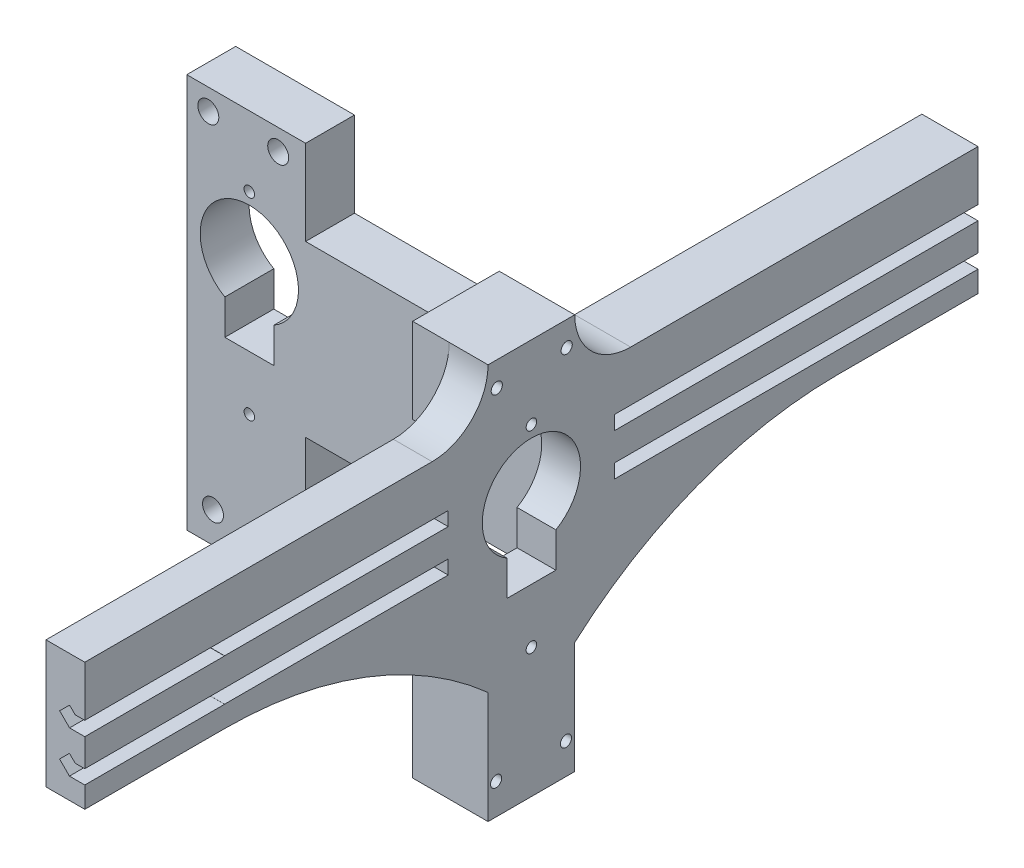
from build123d import *

# Parameters (mm, degrees)
SKETCH1_R                   = 2
BOSS_EXTRUDE3_DEPTH         = 7
SKETCH3_R                   = 1.0000000000000002
SKETCH3_R_2                 = 0.9999999999999998
SKETCH3_R_3                 = 0.9999999999999996
SKETCH3_R_4                 = 0.9999999999999993
CUT_EXTRUDE2_DEPTH          = 26.065122954876703
BOSS_EXTRUDE4_START         = -7
BOSS_EXTRUDE4_DEPTH         = 7
BOSS_EXTRUDE5_START         = -30
BOSS_EXTRUDE5_DEPTH         = 30
FILLET2_R                   = 1.5
CUT_EXTRUDE5_DEPTH          = 42.3486443398461
BOSS_EXTRUDE6_DEPTH         = 10.5
MOVE_START                  = -28.7
MOVE_FACE1_DEPTH            = 5.7
DELETEFACE1_START           = 23.7
DELETEFACE1_OUTLINE_W       = 10.499999999999998
DELETEFACE1_OUTLINE_H       = 35.699999999999996
DELETEFACE1_DEPTH           = 15.7
SKETCH11_OUTSIDE_W          = 51.876
SKETCH11_OUTSIDE_H          = 42.462
CUT_EXTRUDE6_DEPTH          = 46.16926949380306
SERVO_START                 = -12.760864102
SERVO_MICRO_OUTLINE_W       = 22.6
SERVO_MICRO_OUTLINE_H       = 12.399999999999999
SERVO_MICRO_DEPTH           = 22.3
SERVO_START_2               = 9.539135898
SERVO_MICRO_2_DEPTH         = 4.3
SERVO_START_3               = 2.889135898
SERVO_MICRO_3_DEPTH         = 2.4
SERVO_START_4               = 13.839135898
SERVO_MICRO_4_OUTLINE_R     = 2.5
SERVO_MICRO_4_DEPTH         = 3.3
SERVO_START_5               = -25.667487826
SERVO_MICRO_5_OUTLINE_R     = 0.6
SERVO_MICRO_5_DEPTH         = 2.3
SERVO_MICRO_6_OUTLINE_R     = 0.6
SERVO_MICRO_6_DEPTH         = 2.3
SERVO_MICRO_7_OUTLINE_R     = 0.6
SERVO_MICRO_7_DEPTH         = 2.3
BODY_MOVE_COPY1_START       = -28.367487826
BODY_MOVE_COPY1_OUTLINE_W   = 1.4655914419999974
BODY_MOVE_COPY1_OUTLINE_H   = 1.2119180259999993
BODY_MOVE_COPY1_OUTLINE_W_2 = 2.3999999999999995
BODY_MOVE_COPY1_OUTLINE_H_2 = 1.0999999999999943
BODY_MOVE_COPY1_OUTLINE_H_3 = 5.650000000000002
BODY_MOVE_COPY1_DEPTH       = 32.6
BODY_MOVE_COPY1_2_DEPTH     = 23.217487826
BODY_MOVE_COPY1_START_2     = -5.15
BODY_MOVE_COPY1_3_OUTLINE_W = 22.6
BODY_MOVE_COPY1_3_OUTLINE_H = 12.399999999999999
BODY_MOVE_COPY1_3_DEPTH     = 22.3
BODY_MOVE_COPY1_START_3     = 17.15
BODY_MOVE_COPY1_4_DEPTH     = 4.3
BODY_MOVE_COPY1_START_4     = 10.5
BODY_MOVE_COPY1_5_DEPTH     = 2.4
BODY_MOVE_COPY1_START_5     = 21.45
BODY_MOVE_COPY1_6_OUTLINE_R = 2.5
BODY_MOVE_COPY1_6_DEPTH     = 3.3
SKETCH13_R                  = 0.7500000000000021
SKETCH13_W                  = 12.399999999999997
SKETCH13_H                  = 4.160545319150279
BOSS_EXTRUDE7_DEPTH         = 5.55
SKETCH13_3_R                = 0.7500000000000021
SKETCH13_3_W                = 12.399999999999997
SKETCH13_3_H                = 4.160545319150279
BOSS_EXTRUDE8_DEPTH         = 10.8
CUT_EXTRUDE7_DEPTH          = 32
BOSS_EXTRUDE9_DEPTH         = 5.55
CUT_EXTRUDE8_DEPTH          = 72.01254689988379
BOSS_EXTRUDE10_DEPTH        = 5.55
FILLET9_R                   = 1
SKETCH19_W                  = 5.550000000000004
SKETCH19_H                  = 14.059999999999988
BOSS_EXTRUDE11_DEPTH        = 20
CUT_EXTRUDE9_DEPTH          = 20
SKETCH21_W                  = 8.027459463040207
SKETCH21_H                  = 14.059999999999993
BOSS_EXTRUDE12_DEPTH        = 20
CUT_EXTRUDE10_DEPTH         = 20
BOSS_EXTRUDE13_DEPTH        = 60
BOSS_EXTRUDE14_DEPTH        = 58
BOSS_EXTRUDE15_DEPTH        = 8
SKETCH29_R                  = 0.7999999999999987
SKETCH29_R_2                = 0.8000000000000004
CUT_EXTRUDE11_DEPTH         = 20
FILLET10_R                  = 8
SKETCH35_W                  = 27.626929376453724
SKETCH35_H                  = 24.26945468084981
CUT_EXTRUDE14_DEPTH         = 10
SKETCH36_W                  = 6.999999999999999
SKETCH36_H                  = 24.26945468084981
BOSS_EXTRUDE16_DEPTH        = 45
BOSS_EXTRUDE17_DEPTH        = 7
SKETCH40_R                  = 0.7500000000000021
CUT_EXTRUDE16_DEPTH         = 7
SKETCH42_R                  = 1.5000000000000009
SKETCH42_R_2                = 1.5000000000000042
SKETCH42_R_3                = 0.7500000000000021
CUT_EXTRUDE17_DEPTH         = 7
SKETCH44_W                  = 10.800000000000004
SKETCH44_H                  = 12.399999999999997
BOSS_EXTRUDE18_DEPTH        = 16
SKETCH45_R                  = 0.7999999999999987
SKETCH45_R_2                = 0.8000000000000004
CUT_EXTRUDE18_DEPTH         = 16
CUT_EXTRUDE19_DEPTH         = 16


# Read off the part's stored shape, not the designer's step: Move Face1, DeleteFace1, Servo Micro, Body-Move/Copy1
with BuildPart() as part:
    # Sketch1 → Boss-Extrude3 (new body)
    with BuildSketch(Plane.XY):
        with BuildLine():
            Line((5.606455718863049, 13.824363162033857), (-15, 15.748663077959565))
            Line((-15, 15.748663077959565), (-14.999999999999993, -15.748663077959552))
            Line((-14.999999999999993, -15.748663077959552), (5.606455718863063, -13.824363162033817))
            ThreePointArc((5.606455718863063, -13.824363162033817), (18.200000000000003, 2.613e-14), (5.606455718863049, 13.824363162033857))
        make_face()
        Circle(SKETCH1_R, mode=Mode.SUBTRACT)
    extrude(amount=BOSS_EXTRUDE3_DEPTH)

    # Sketch3 → Cut-Extrude2 (cut, through all)
    with BuildSketch(Plane.XY.offset(7)):
        with Locations((-4.5, 0)):
            Circle(SKETCH3_R)
        with Locations((-8.499999999999998, 0)):
            Circle(SKETCH3_R_2)
        with Locations(Location((4.5, -1.73e-15, 0), (0, 0, 180))):
            Circle(SKETCH3_R_3)
        with Locations(Location((8.499999999999998, -1.73e-15, 0), (0, 0, 180))):
            Circle(SKETCH3_R_4)
    extrude(amount=-CUT_EXTRUDE2_DEPTH, mode=Mode.SUBTRACT)

    # Sketch6 → Boss-Extrude4 (add)
    with BuildSketch(Plane.XY.offset(7).offset(BOSS_EXTRUDE4_START)):
        with BuildLine():
            Line((12.20372638619735, 13.208287910486863), (5.606455718863047, 13.824363162033858))
            ThreePointArc((5.606455718863047, 13.82436316203386), (18.2, 2.598e-14), (5.606455718863056, -13.824363162033816))
            Line((5.606455718863056, -13.824363162033816), (12.203726386197348, -13.208287910486817))
            ThreePointArc((12.203726386197348, -13.208287910486817), (19.699999999999996, 2.132e-14), (12.20372638619735, 13.20828791048686))
        make_face()
    extrude(amount=BOSS_EXTRUDE4_DEPTH)

    # Sketch6<3> → Boss-Extrude5 (add)
    with BuildSketch(Plane.XY.offset(7).offset(BOSS_EXTRUDE5_START)):
        with BuildLine():
            Line((23.700000000000006, 12.13472734042489), (12.20372638619735, 13.208287910486863))
            ThreePointArc((12.20372638619735, 13.20828791048686), (19.699999999999996, 2.132e-14), (12.203726386197348, -13.208287910486817))
            Line((12.203726386197348, -13.208287910486817), (23.700000000000003, -12.134727340424835))
            Line((23.700000000000003, -12.134727340424835), (23.700000000000006, 12.134727340424892))
        make_face()
    extrude(amount=BOSS_EXTRUDE5_DEPTH)

    # Fillet2
    fillet2_edges = [part.edges().sort_by_distance(p)[0] for p in [
        (12.20372638619735, -13.208287910486817, -11.5),
        (12.20372638619735, 13.208287910486861, -11.5),
    ]]
    fillet(fillet2_edges, radius=FILLET2_R)

    # Sketch8 → Cut-Extrude5 (cut, through all)
    with BuildSketch(Plane.XY.offset(7)):
        with BuildLine():
            Line((-15, 15.748663077959565), (-14.999999999999993, -15.748663077959554))
            Line((-14.999999999999993, -15.748663077959552), (1.3282730568923533, -14.22387420115003))
            ThreePointArc((1.3282730568923518, -14.22387420115002), (-14.285758873920813, 0), (1.3282730568923529, 14.22387420115002))
            Line((1.3282730568923533, 14.22387420115006), (-14.999999999999996, 15.748663077959565))
        make_face()
    extrude(amount=-CUT_EXTRUDE5_DEPTH, mode=Mode.SUBTRACT)

    # Sketch10 → Boss-Extrude6 (add)
    with BuildSketch(Plane.ZX.offset(1.6347273404248903)):
        Polygon((7, 23.700000000000003), (6.999999999999999, 39.40000000018666), (-28.700000000000003, 39.40000000018665), (-28.7, 23.700000000000003), align=None)
    extrude(amount=BOSS_EXTRUDE6_DEPTH)

    # Move Face1 outline → Move Face1 (add)
    with BuildSketch(Plane.XY.offset(MOVE_START)):
        with BuildLine():
            Line((17.033263706, -12.757289525), (23.7, -12.13472734))
            Line((23.7, -12.13472734), (23.7, 12.13472734))
            Line((23.7, 12.13472734), (17.033263706, 12.757289525))
            ThreePointArc((17.033263706, 12.757289525), (15.554272674, 11.938827155), (15.776353621, 10.263125757))
            ThreePointArc((15.776353621, 10.263125757), (19.7, 0), (15.776353621, -10.263125757))
            ThreePointArc((15.776353621, -10.263125757), (15.554272674, -11.938827155), (17.033263706, -12.757289525))
        make_face()
    extrude(amount=MOVE_FACE1_DEPTH)

    # DeleteFace1 outline → DeleteFace1 (cut)
    with BuildSketch(Plane.YZ.offset(DELETEFACE1_START)):
        with Locations((6.884727339999999, -10.849999999999998)):
            Rectangle(DELETEFACE1_OUTLINE_W, DELETEFACE1_OUTLINE_H)
    extrude(amount=DELETEFACE1_DEPTH, mode=Mode.SUBTRACT)

    # Sketch11 outside → Cut-Extrude6 (cut, through all)
    with BuildSketch(Plane.XY.offset(7)):
        with Locations((4.706999999999997, 0)):
            Rectangle(SKETCH11_OUTSIDE_W, SKETCH11_OUTSIDE_H)
        with BuildLine():
            Line((23.700000000000003, 12.134727340424888), (-1.43e-15, 12.134727340424885))
            ThreePointArc((-1.43e-15, 12.134727340424885), (-12.134727340424885, 1.49e-15), (0, -12.134727340424885))
            Line((0, -12.134727340424885), (23.700000000000006, -12.134727340424835))
            Line((23.700000000000006, -12.134727340424835), (23.700000000000003, 12.134727340424888))
        make_face(mode=Mode.SUBTRACT)
    extrude(amount=-CUT_EXTRUDE6_DEPTH, mode=Mode.SUBTRACT)

    # Sketch13 → Boss-Extrude7 (add)
    # profile 1 of 3: a face of its own
    with BuildSketch(Plane(origin=(23.700000000000003, -3.39e-15, 0), x_dir=(0, 0, -1), z_dir=(1, -1.4e-16, 0))):
        Polygon((-9.000000000000002, -16.295272659575108), (-9.000000000000002, -12.134727340424831), (-7, -12.134727340424831), (-7.000000000000001, 12.134727340424892), (-9.000000000000002, 12.13472734042489), (-9.000000000000002, 16.30472734042489), (-21.4, 16.30472734042489), (-21.399999999999995, 12.13472734042489), (-59.1, 12.134727340424885), (-59.1, -12.134727340424831), (-21.4, -12.134727340424831), (-21.4, -16.295272659575108), align=None)
        with Locations(Location((-15.200000000000001, 13.804727340424892, 0), (0, 0, 90))):
            Circle(SKETCH13_R, mode=Mode.SUBTRACT)
        with Locations(Location((-15.200000000000001, -13.79527265957511, 0), (0, 0, 90))):
            Circle(SKETCH13_R, mode=Mode.SUBTRACT)
        with BuildLine():
            ThreePointArc((-11.700000000000003, -0.9920668991734932), (-15.2, 12.134727340424892), (-18.700000000000003, -0.9920668991734932))
            Line((-18.700000000000003, -0.9920668991734932), (-18.700000000000003, -5.992066899173493))
            Line((-18.700000000000003, -5.992066899173493), (-11.700000000000003, -5.992066899173493))
            Line((-11.700000000000003, -5.992066899173493), (-11.700000000000003, -0.9920668991734932))
        make_face(mode=Mode.SUBTRACT)
    # profile 2 of 3: a face of its own
    with BuildSketch(Plane(origin=(23.700000000000003, -3.39e-15, 0), x_dir=(0, 0, -1), z_dir=(1, -1.4e-16, 0))):
        Polygon((-21.399999999999995, 12.13472734042489), (-21.4, 16.30472734042489), (-9.000000000000002, 16.30472734042489), (-9.000000000000002, 12.13472734042489), align=None)
        with Locations(Location((-15.200000000000001, 13.804727340424892, 0), (0, 0, 90))):
            Circle(SKETCH13_R, mode=Mode.SUBTRACT)
    # profile 3 of 3: a face of its own
    with BuildSketch(Plane(origin=(23.700000000000003, -3.39e-15, 0), x_dir=(0, 0, -1), z_dir=(1, -1.4e-16, 0))):
        with Locations((-15.2, -14.214999999999968)):
            Rectangle(SKETCH13_W, SKETCH13_H)
        with Locations(Location((-15.200000000000001, -13.79527265957511, 0), (0, 0, 90))):
            Circle(SKETCH13_R, mode=Mode.SUBTRACT)
    extrude(amount=-BOSS_EXTRUDE7_DEPTH)

    # Sketch13<3> → Boss-Extrude8 (add)
    # profile 1 of 2: a face of its own
    with BuildSketch(Plane(origin=(23.700000000000003, -3.39e-15, 0), x_dir=(0, 0, -1), z_dir=(1, -1.4e-16, 0))):
        Polygon((-21.399999999999995, 12.13472734042489), (-21.4, 16.30472734042489), (-9.000000000000002, 16.30472734042489), (-9.000000000000002, 12.13472734042489), align=None)
        with Locations(Location((-15.200000000000001, 13.804727340424892, 0), (0, 0, 90))):
            Circle(SKETCH13_3_R, mode=Mode.SUBTRACT)
    # profile 2 of 2: a face of its own
    with BuildSketch(Plane(origin=(23.700000000000003, -3.39e-15, 0), x_dir=(0, 0, -1), z_dir=(1, -1.4e-16, 0))):
        with Locations((-15.2, -14.214999999999968)):
            Rectangle(SKETCH13_3_W, SKETCH13_3_H)
        with Locations(Location((-15.200000000000001, -13.79527265957511, 0), (0, 0, 90))):
            Circle(SKETCH13_3_R, mode=Mode.SUBTRACT)
    extrude(amount=-BOSS_EXTRUDE8_DEPTH)

    # Sketch15 → Cut-Extrude7 (cut)
    with BuildSketch(Plane(origin=(-6.34e-15, 0, -28.699999999999992), x_dir=(-1, 0, -6.6e-16), z_dir=(6.6e-16, 0, -1))):
        Polygon((-22.328427124746177, 3.104727340424887), (-23.699999999999985, 3.104727340424887), (-23.699999999999985, 1.1047273404248876), (-21.499999999999986, 1.1047273404248876), (-20.08578643762689, 2.5189409027979854), (-21.49999999999999, 3.9331544651710773), align=None)
        Polygon((-22.328427124746177, 9.104727340424887), (-23.699999999999985, 9.104727340424887), (-23.699999999999985, 7.104727340424887), (-21.499999999999986, 7.104727340424887), (-20.08578643762689, 8.518940902797986), (-21.49999999999999, 9.933154465171077), align=None)
    cut_extrude7 = extrude(amount=-CUT_EXTRUDE7_DEPTH, mode=Mode.SUBTRACT)

    # Mirror1: Cut-Extrude7 across plane
    add(cut_extrude7.mirror(Plane(origin=(0, 0, 15.200000000000001), x_dir=(1, 0, 0), z_dir=(0, 0, -1))), mode=Mode.SUBTRACT)

    # Sketch16 → Boss-Extrude9 (add)
    with BuildSketch(Plane(origin=(23.700000000000003, -3.39e-15, 0), x_dir=(0, 0, -1), z_dir=(1, -1.4e-16, 0))):
        with BuildLine():
            Line((-21.399999999999995, 12.13472734042489), (-21.4, 16.30472734042489))
            ThreePointArc((-21.4, 16.30472734042489), (-40.135039546574305, 13.18039662240372), (-59.1, 12.134727340424885))
            Line((-59.1, 12.134727340424885), (-21.399999999999995, 12.13472734042489))
        make_face()
        with BuildLine():
            Line((-9.000000000000002, 16.30472734042489), (-9.000000000000002, 12.134727340424892))
            Line((-9.000000000000002, 12.134727340424892), (28.7, 12.134727340424892))
            ThreePointArc((28.7, 12.134727340424892), (9.735039546574328, 13.180396622403748), (-9.000000000000002, 16.30472734042489))
        make_face()
    extrude(amount=-BOSS_EXTRUDE9_DEPTH)

    # Sketch18 → Cut-Extrude8 (cut, through all)
    with BuildSketch(Plane(origin=(23.700000000000003, -3.39e-15, 0), x_dir=(0, 0, -1), z_dir=(1, -1.4e-16, 0))):
        with BuildLine():
            Line((-59.1, -12.134727340424831), (-26.661429094135947, -12.134727340424831))
            ThreePointArc((-26.66142909413584, -12.13472734042469), (-42.096369157624764, -4.537893974213446), (-59.09999999999998, -1.9252726595751))
            Line((-59.09999999999998, -1.9252726595751037), (-59.1, -12.134727340424831))
        make_face()
        with BuildLine():
            Line((-3.7385709058640586, -12.134727340424831), (28.69999999999999, -12.134727340424831))
            Line((28.69999999999999, -12.134727340424831), (28.69999999999998, -1.9252726595751037))
            ThreePointArc((28.69999999999998, -1.925272659575107), (11.696369157624773, -4.537893974213453), (-3.738570905864158, -12.134727340424696))
        make_face()
    extrude(amount=-CUT_EXTRUDE8_DEPTH, mode=Mode.SUBTRACT)

    # Sketch18<3> → Boss-Extrude10 (add)
    with BuildSketch(Plane(origin=(23.700000000000003, -3.39e-15, 0), x_dir=(0, 0, -1), z_dir=(1, -1.4e-16, 0))):
        with BuildLine():
            ThreePointArc((-26.66142909413584, -12.13472734042469), (-23.969068948896194, -14.137042924937354), (-21.4, -16.29527265957511))
            Line((-21.4, -16.295272659575108), (-21.4, -12.134727340424831))
            Line((-21.4, -12.134727340424831), (-26.661429094135944, -12.134727340424831))
        make_face()
        with BuildLine():
            ThreePointArc((-9, -16.29527265957511), (-6.430931051103812, -14.137042924937347), (-3.738570905864158, -12.134727340424696))
            Line((-3.7385709058640604, -12.134727340424831), (-9.000000000000005, -12.134727340424831))
            Line((-9.000000000000005, -12.134727340424831), (-9.000000000000005, -16.295272659575108))
        make_face()
    extrude(amount=-BOSS_EXTRUDE10_DEPTH)

    # Fillet9
    fillet9_edges = [part.edges().sort_by_distance(p)[0] for p in [
        (18.150000000000002, 2.76e-14, 7),
    ]]
    fillet(fillet9_edges, radius=FILLET9_R)

    # Sketch19 → Boss-Extrude11 (add)
    with BuildSketch(Plane.XY.offset(59.1)):
        with Locations((20.925, 5.104727340424887)):
            Rectangle(SKETCH19_W, SKETCH19_H)
    extrude(amount=BOSS_EXTRUDE11_DEPTH)

    # Sketch20 → Cut-Extrude9 (cut)
    with BuildSketch(Plane.XY.offset(79.10000000000001)):
        Polygon((23.722110207744855, 7.076488781049606), (23.722110207744855, 9.104727340424887), (22.32229877311573, 9.104727340424887), (21.522110207744838, 9.904915905795775), (20.107896645371763, 8.490702343422699), (21.522110207744856, 7.076488781049606), align=None)
        Polygon((23.70401004449683, 1.0934240658721006), (23.70401004449683, 3.104727340424886), (22.3211338946902, 3.104727340424886), (21.504010044496816, 3.92185119061827), (20.08979648212374, 2.507637628245194), (21.504010044496834, 1.0934240658721002), align=None)
    extrude(amount=-CUT_EXTRUDE9_DEPTH, mode=Mode.SUBTRACT)

    # Sketch21 → Boss-Extrude12 (add)
    with BuildSketch(Plane(origin=(-6.34e-15, 0, -28.699999999999992), x_dir=(-1, 0, -6.6e-16), z_dir=(6.6e-16, 0, -1))):
        with Locations((-19.68627026847988, 5.10472734042489)):
            Rectangle(SKETCH21_W, SKETCH21_H)
    extrude(amount=BOSS_EXTRUDE12_DEPTH)

    # Sketch24 → Cut-Extrude10 (cut)
    with BuildSketch(Plane(origin=(4.21e-14, 0, -48.699999999999996), x_dir=(-1, 0, -8.6e-16), z_dir=(8.6e-16, 0, -1))):
        Polygon((-23.699999999999978, 9.104727340424887), (-22.32842712474612, 9.104727340424887), (-21.499999999999954, 9.933154465171054), (-20.085786437626883, 8.518940902797985), (-21.499999999999982, 7.104727340424887), (-23.699999999999978, 7.104727340424887), align=None)
        Polygon((-23.699999999999978, 3.104727340424887), (-22.32842712474617, 3.104727340424887), (-21.499999999999982, 3.9331544651710755), (-20.085786437626886, 2.518940902797982), (-21.499999999999982, 1.1047273404248876), (-23.699999999999978, 1.1047273404248874), align=None)
    extrude(amount=-CUT_EXTRUDE10_DEPTH, mode=Mode.SUBTRACT)

    # Sketch25 → Boss-Extrude13 (add)
    with BuildSketch(Plane.XY.offset(79.10000000000001)):
        Polygon((18.15, 11.134900945648951), (23.700000000000003, 11.134900945648951), (23.700000000000006, 16.304727340424886), (18.15, 16.304727340424886), align=None)
    extrude(amount=-BOSS_EXTRUDE13_DEPTH)

    # Sketch27 → Boss-Extrude14 (add)
    with BuildSketch(Plane(origin=(4.21e-14, 0, -48.699999999999996), x_dir=(-1, 0, -8.6e-16), z_dir=(8.6e-16, 0, -1))):
        Polygon((-23.699999999999978, 10.619727340424886), (-15.672540536959767, 10.619727340424886), (-15.672540536959767, 16.304727340424886), (-23.700000000000014, 16.304727340424886), align=None)
    extrude(amount=-BOSS_EXTRUDE14_DEPTH)

    # Sketch28 → Boss-Extrude15 (add)
    with BuildSketch(Plane(origin=(2.33e-15, 16.30472734042489, 0), x_dir=(1, -1.4e-16, 0), z_dir=(1.4e-16, 1, 0))):
        Polygon((12.9, -21.4), (23.700000000000003, -21.400000000000006), (23.70000000000003, -8.999999999999998), (12.9, -8.999999999999998), align=None)
    extrude(amount=BOSS_EXTRUDE15_DEPTH)

    # Sketch29 → Cut-Extrude11 (cut)
    with BuildSketch(Plane(origin=(23.700000000000003, -3.39e-15, 0), x_dir=(0, 0, -1), z_dir=(1, -1.4e-16, 0))):
        with Locations(Location((-20.150943335885394, 20.804727340424893, 0), (0, 0, 90))):
            Circle(SKETCH29_R)
        with Locations(Location((-10.150943335885394, 20.804727340424893, 0), (0, 0, 90))):
            Circle(SKETCH29_R_2)
    extrude(amount=-CUT_EXTRUDE11_DEPTH, mode=Mode.SUBTRACT)

    # Fillet10
    fillet10_edges = [part.edges().sort_by_distance(p)[0] for p in [
        (20.925000000000008, 16.304727340424886, 21.400000000000002),
        (19.6862702684799, 16.304727340424886, 8.999999999999998),
    ]]
    fillet(fillet10_edges, radius=FILLET10_R - 0.0001)  # a hair under: the kernel refuses the full size

    # Sketch35 → Cut-Extrude14 (cut)
    with BuildSketch(Plane(origin=(0, 0, 0), x_dir=(-1, 0, 0), z_dir=(0, 0, -1))):
        with Locations((2.6231472769346906, -1.954e-14)):
            Rectangle(SKETCH35_W, SKETCH35_H)
    extrude(amount=-CUT_EXTRUDE14_DEPTH, mode=Mode.SUBTRACT)

    # Sketch36 → Boss-Extrude16 (add)
    with BuildSketch(Plane.ZY.offset(-11.190317411292172)):
        with Locations((3.4999999999999996, -1.954e-14)):
            Rectangle(SKETCH36_W, SKETCH36_H)
    extrude(amount=BOSS_EXTRUDE16_DEPTH)

    # Sketch38 → Boss-Extrude17 (add)
    with BuildSketch(Plane(origin=(0, 0, 0), x_dir=(-1, 0, 0), z_dir=(0, 0, -1))):
        Polygon((16.80968258870782, 27.134727340424888), (33.80968258870783, 27.134727340424888), (33.80968258870783, -32.134727340424924), (16.809682588707833, -32.134727340424924), align=None)
    extrude(amount=-BOSS_EXTRUDE17_DEPTH)

    # Sketch40 → Cut-Extrude16 (cut)
    with BuildSketch(Plane(origin=(0, 0, 0), x_dir=(-1, 0, 0), z_dir=(0, 0, -1))):
        with Locations((24.858757106439807, -13.319665977674164)):
            Circle(SKETCH40_R)
        with BuildLine():
            Line((21.358757106439807, -0.5164602172725488), (21.358757106439807, -5.51646021727255))
            Line((21.358757106439807, -5.51646021727255), (28.358757106439807, -5.51646021727255))
            Line((28.358757106439807, -5.51646021727255), (28.358757106439807, -0.5164602172725492))
            ThreePointArc((28.358757106439807, -0.5164602172725492), (24.858757106439807, 12.610334022325837), (21.358757106439807, -0.5164602172725488))
        make_face()
        with Locations((24.858757106439807, 14.280334022325833)):
            Circle(SKETCH40_R)
    extrude(amount=-CUT_EXTRUDE16_DEPTH, mode=Mode.SUBTRACT)

    # Sketch42 → Cut-Extrude17 (cut)
    with BuildSketch(Plane(origin=(0, 0, 0), x_dir=(-1, 0, 0), z_dir=(0, 0, -1))):
        with Locations((20.726567546333285, 21.280334022325835)):
            Circle(SKETCH42_R)
        with Locations((30.72656754633329, 21.280334022325835)):
            Circle(SKETCH42_R_2)
        with Locations((20.05370904329396, -27.71966597767417)):
            Circle(SKETCH42_R)
        with Locations((30.053709043293964, -27.71966597767417)):
            Circle(SKETCH42_R_2)
        with Locations((24.858757106439807, 14.280334022325833)):
            Circle(SKETCH42_R_3)
    extrude(amount=-CUT_EXTRUDE17_DEPTH, mode=Mode.SUBTRACT)

    # Sketch44 → Boss-Extrude18 (add)
    with BuildSketch(Plane.XZ.offset(16.295272659575108)):
        with Locations((18.3, 15.2)):
            Rectangle(SKETCH44_W, SKETCH44_H)
    extrude(amount=BOSS_EXTRUDE18_DEPTH)

    # Sketch45 → Cut-Extrude18 (cut)
    with BuildSketch(Plane.ZY.offset(-12.9)):
        with Locations(Location((20.25, -27.87869925364994, 0), (0, 0, 270))):
            Circle(SKETCH45_R)
        with Locations(Location((10.25, -27.87869925364994, 0), (0, 0, 270))):
            Circle(SKETCH45_R_2)
    extrude(amount=-CUT_EXTRUDE18_DEPTH, mode=Mode.SUBTRACT)

    # Sketch46 → Cut-Extrude19 (cut)
    with BuildSketch(Plane.XY.offset(7)):
        Polygon((-33.80968258870783, 27.134727340424888), (-16.809682588707815, 27.134727340424888), (-16.80968258870782, 24.304727340424886), (-33.80968258870783, 24.304727340424886), align=None)
    extrude(amount=-CUT_EXTRUDE19_DEPTH, mode=Mode.SUBTRACT)


with BuildPart() as body_2:
    # Servo Micro outline → Servo Micro (new body)
    with BuildSketch(Plane(origin=(0, 0, 0), x_dir=(1, 0, 0), z_dir=(0, 1, 0)).offset(SERVO_START)):
        with Locations((-12.067487826, -26.388081974)):
            Rectangle(SERVO_MICRO_OUTLINE_W, SERVO_MICRO_OUTLINE_H)
    extrude(amount=SERVO_MICRO_DEPTH)

    # Servo Micro 2 outline → Servo Micro 2 (add)
    with BuildSketch(Plane(origin=(0, 0, 0), x_dir=(1, 0, 0), z_dir=(0, 1, 0)).offset(SERVO_START_2)):
        with BuildLine():
            ThreePointArc((-11.10082116, -25.109193568), (-23.367487826, -26.388081974), (-11.10082116, -27.666970381))
            ThreePointArc((-11.10082116, -27.666970381), (-9.567487826, -26.388081975), (-11.10082116, -25.109193568))
        make_face()
    extrude(amount=SERVO_MICRO_2_DEPTH)

    # Servo Micro 3 outline → Servo Micro 3 (add)
    with BuildSketch(Plane(origin=(0, 0, 0), x_dir=(1, 0, 0), z_dir=(0, 1, 0)).offset(SERVO_START_3)):
        with BuildLine():
            Line((2.567676828, -25.838081974), (4.232512174, -25.838081974))
            Line((4.232512174, -25.838081974), (4.232512174, -20.188081974))
            Line((4.232512174, -20.188081974), (-0.767487826, -20.188081974))
            Line((-0.767487826, -20.188081974), (-0.767487826, -32.588081974))
            Line((-0.767487826, -32.588081974), (4.232512174, -32.588081974))
            Line((4.232512174, -32.588081974), (4.232512174, -26.938081974))
            Line((4.232512174, -26.938081974), (2.567676828, -26.938081974))
            ThreePointArc((2.567676828, -26.938081974), (0.732512174, -26.388081974), (2.567676828, -25.838081974))
        make_face()
        with BuildLine():
            Line((-23.367487826, -32.588081974), (-23.367487826, -20.188081974))
            Line((-23.367487826, -20.188081974), (-28.367487826, -20.188081974))
            Line((-28.367487826, -20.188081974), (-28.367487826, -25.838081974))
            Line((-28.367487826, -25.838081974), (-26.702652481, -25.838081974))
            ThreePointArc((-26.702652481, -25.838081974), (-24.867487826, -26.388081974), (-26.702652481, -26.938081974))
            Line((-26.702652481, -26.938081974), (-28.367487826, -26.938081974))
            Line((-28.367487826, -26.938081974), (-28.367487826, -32.588081974))
            Line((-28.367487826, -32.588081974), (-23.367487826, -32.588081974))
        make_face()
    extrude(amount=SERVO_MICRO_3_DEPTH)

    # Servo Micro 4 outline → Servo Micro 4 (add)
    with BuildSketch(Plane(origin=(0, 0, 0), x_dir=(1, 0, 0), z_dir=(0, 1, 0)).offset(SERVO_START_4)):
        with Locations((-17.167487826, -26.388081974)):
            Circle(SERVO_MICRO_4_OUTLINE_R)
    extrude(amount=SERVO_MICRO_4_DEPTH)

    # Body-Move/Copy1 outline → Body-Move/Copy1 (cut)
    with BuildSketch(Plane.YZ.offset(BODY_MOVE_COPY1_START)):
        with BuildLine():
            Line((-16.29527266, 9), (-16.29527266, 14.65))
            Line((-16.29527266, 14.65), (-14.630437314, 14.65))
            ThreePointArc((-14.630437314, 14.65), (-12.79527266, 15.2), (-14.630437314, 15.75))
            Line((-14.630437314, 15.75), (-16.29527266, 15.75))
            Line((-16.29527266, 15.75), (-16.29527266, 21.4))
            Line((-16.29527266, 21.4), (-12.760864102, 21.4))
            Line((-12.760864102, 21.4), (-12.760864102, 32.588081974))
            Line((-12.760864102, 32.588081974), (2.889135898, 32.588081974))
            Line((2.889135898, 32.588081974), (5.289135898, 32.588081974))
            Line((5.289135898, 32.588081974), (9.539135898, 32.588081974))
            Line((9.539135898, 32.588081974), (9.539135898, 26.388081974))
            Line((9.539135898, 26.388081974), (9.539135898, 21.4))
            Line((9.539135898, 21.4), (11.30472734, 21.4))
            Line((11.30472734, 21.4), (13.839135898, 21.4))
            Line((13.839135898, 21.4), (13.839135898, 32.588081974))
            Line((13.839135898, 32.588081974), (13.839135898, 34))
            Line((13.839135898, 34), (-18, 34))
            Line((-18, 34), (-18, 8))
            Line((-18, 8), (13.839135898, 8))
            Line((13.839135898, 8), (13.839135898, 9))
            Line((13.839135898, 9), (11.30472734, 9))
            Line((11.30472734, 9), (5.10472734, 9))
            Line((5.10472734, 9), (-11.29527266, 9))
            Line((-11.29527266, 9), (-16.29527266, 9))
        make_face()
        with Locations((-12.028068380999999, 20.794040987)):
            Rectangle(BODY_MOVE_COPY1_OUTLINE_W, BODY_MOVE_COPY1_OUTLINE_H)
        Polygon((-12.760864102, 21.4), (-11.29527266, 21.4), (2.889135898, 21.4), (2.889135898, 25.838081974), (2.889135898, 26.938081974), (2.889135898, 32.588081974), (-12.760864102, 32.588081974), align=None)
        with BuildLine():
            Line((11.30472734, 15.2), (11.30472734, 9))
            Line((11.30472734, 9), (13.839135898, 9))
            Line((13.839135898, 9), (13.839135898, 14.200592149))
            ThreePointArc((13.839135898, 14.200592149), (12.80472734, 15.2), (13.839135898, 16.199407851))
            Line((13.839135898, 16.199407851), (13.839135898, 20.188081974))
            Line((13.839135898, 20.188081974), (13.839135898, 21.4))
            Line((13.839135898, 21.4), (11.30472734, 21.4))
            Line((11.30472734, 21.4), (11.30472734, 15.2))
        make_face()
        Polygon((2.889135898, 25.838081974), (2.889135898, 21.4), (5.104727162, 21.4), (5.289135898, 21.4), (5.289135898, 25.838081974), align=None)
        with BuildLine():
            Line((16.30472734, 9), (13.839135898, 9))
            Line((13.839135898, 9), (13.839135898, 8))
            Line((13.839135898, 8), (17.139135898, 8))
            Line((17.139135898, 8), (17.139135898, 23.888081974))
            Line((17.139135898, 23.888081974), (17.139135898, 28.888081974))
            Line((17.139135898, 28.888081974), (17.139135898, 34))
            Line((17.139135898, 34), (13.839135898, 34))
            Line((13.839135898, 34), (13.839135898, 32.588081974))
            Line((13.839135898, 32.588081974), (13.839135898, 21.4))
            Line((13.839135898, 21.4), (16.30472734, 21.4))
            Line((16.30472734, 21.4), (16.30472734, 15.75))
            Line((16.30472734, 15.75), (14.639891995, 15.75))
            ThreePointArc((14.639891995, 15.75), (14.294146636, 16.072048596), (13.839135898, 16.199407851))
            Line((13.839135898, 16.199407851), (13.839135898, 14.200592149))
            ThreePointArc((13.839135898, 14.200592149), (14.294146636, 14.327951404), (14.639891995, 14.65))
            Line((14.639891995, 14.65), (16.30472734, 14.65))
            Line((16.30472734, 14.65), (16.30472734, 9))
        make_face()
        with Locations((4.089135898, 26.388081974)):
            Rectangle(BODY_MOVE_COPY1_OUTLINE_W_2, BODY_MOVE_COPY1_OUTLINE_H_2)
        Polygon((5.289135898, 21.4), (9.539135898, 21.4), (9.539135898, 26.388081974), (9.539135898, 32.588081974), (5.289135898, 32.588081974), (5.289135898, 26.938081974), (5.289135898, 25.838081974), align=None)
        with Locations((4.089135898, 29.763081973999995)):
            Rectangle(BODY_MOVE_COPY1_OUTLINE_W_2, BODY_MOVE_COPY1_OUTLINE_H_3)
    extrude(amount=BODY_MOVE_COPY1_DEPTH, mode=Mode.SUBTRACT)

    # Body-Move_Copy1 2 outline → Body-Move_Copy1 2 (cut)
    with BuildSketch(Plane.YZ.offset(BODY_MOVE_COPY1_START)):
        with BuildLine():
            Line((-11.29527266, 21.4), (-11.29527266, 20.188081974))
            Line((-11.29527266, 20.188081974), (8.786987274, 20.188081974))
            ThreePointArc((8.786987274, 20.188081974), (10.639617203, 17.993741972), (11.30472734, 15.2))
            Line((11.30472734, 15.2), (11.30472734, 21.4))
            Line((11.30472734, 21.4), (-11.29527266, 21.4))
        make_face()
    extrude(amount=BODY_MOVE_COPY1_2_DEPTH, mode=Mode.SUBTRACT)

    # Body-Move_Copy1 3 outline → Body-Move_Copy1 3 (add)
    with BuildSketch(Plane.YZ.offset(BODY_MOVE_COPY1_START_2)):
        with Locations((0.00472733999999964, 15.2)):
            Rectangle(BODY_MOVE_COPY1_3_OUTLINE_W, BODY_MOVE_COPY1_3_OUTLINE_H)
    extrude(amount=BODY_MOVE_COPY1_3_DEPTH)

    # Body-Move_Copy1 4 outline → Body-Move_Copy1 4 (add)
    with BuildSketch(Plane.YZ.offset(BODY_MOVE_COPY1_START_3)):
        with BuildLine():
            ThreePointArc((-0.961939326, 13.921111594), (11.30472734, 15.2), (-0.961939326, 16.478888406))
            ThreePointArc((-0.961939326, 16.478888406), (-2.49527266, 15.2), (-0.961939326, 13.921111594))
        make_face()
    extrude(amount=BODY_MOVE_COPY1_4_DEPTH)

    # Body-Move_Copy1 5 outline → Body-Move_Copy1 5 (add)
    with BuildSketch(Plane.YZ.offset(BODY_MOVE_COPY1_START_4)):
        with BuildLine():
            Line((-14.630437314, 14.65), (-16.29527266, 14.65))
            Line((-16.29527266, 14.65), (-16.29527266, 9))
            Line((-16.29527266, 9), (-11.29527266, 9))
            Line((-11.29527266, 9), (-11.29527266, 21.4))
            Line((-11.29527266, 21.4), (-16.29527266, 21.4))
            Line((-16.29527266, 21.4), (-16.29527266, 15.75))
            Line((-16.29527266, 15.75), (-14.630437314, 15.75))
            ThreePointArc((-14.630437314, 15.75), (-12.79527266, 15.2), (-14.630437314, 14.65))
        make_face()
        with BuildLine():
            Line((11.30472734, 9), (16.30472734, 9))
            Line((16.30472734, 9), (16.30472734, 14.65))
            Line((16.30472734, 14.65), (14.639891995, 14.65))
            ThreePointArc((14.639891995, 14.65), (12.80472734, 15.2), (14.639891995, 15.75))
            Line((14.639891995, 15.75), (16.30472734, 15.75))
            Line((16.30472734, 15.75), (16.30472734, 21.4))
            Line((16.30472734, 21.4), (11.30472734, 21.4))
            Line((11.30472734, 21.4), (11.30472734, 9))
        make_face()
    extrude(amount=BODY_MOVE_COPY1_5_DEPTH)

    # Body-Move_Copy1 6 outline → Body-Move_Copy1 6 (add)
    with BuildSketch(Plane.YZ.offset(BODY_MOVE_COPY1_START_5)):
        with Locations((5.10472734, 15.2)):
            Circle(BODY_MOVE_COPY1_6_OUTLINE_R)
    extrude(amount=BODY_MOVE_COPY1_6_DEPTH)


with BuildPart() as body_3:
    # Servo Micro 5 outline → Servo Micro 5 (new body)
    with BuildSketch(Plane.YZ.offset(SERVO_START_5)):
        with Locations((-8.260864102, 25.188081974)):
            Circle(SERVO_MICRO_5_OUTLINE_R)
    extrude(amount=SERVO_MICRO_5_DEPTH)


with BuildPart() as body_4:
    # Servo Micro 6 outline → Servo Micro 6 (new body)
    with BuildSketch(Plane.YZ.offset(SERVO_START_5)):
        with Locations((-8.260864102, 27.588081974)):
            Circle(SERVO_MICRO_6_OUTLINE_R)
    extrude(amount=SERVO_MICRO_6_DEPTH)


with BuildPart() as body_5:
    # Servo Micro 7 outline → Servo Micro 7 (new body)
    with BuildSketch(Plane.YZ.offset(SERVO_START_5)):
        with Locations((-8.260864102, 26.388081974)):
            Circle(SERVO_MICRO_7_OUTLINE_R)
    extrude(amount=SERVO_MICRO_7_DEPTH)


solid = part.part
